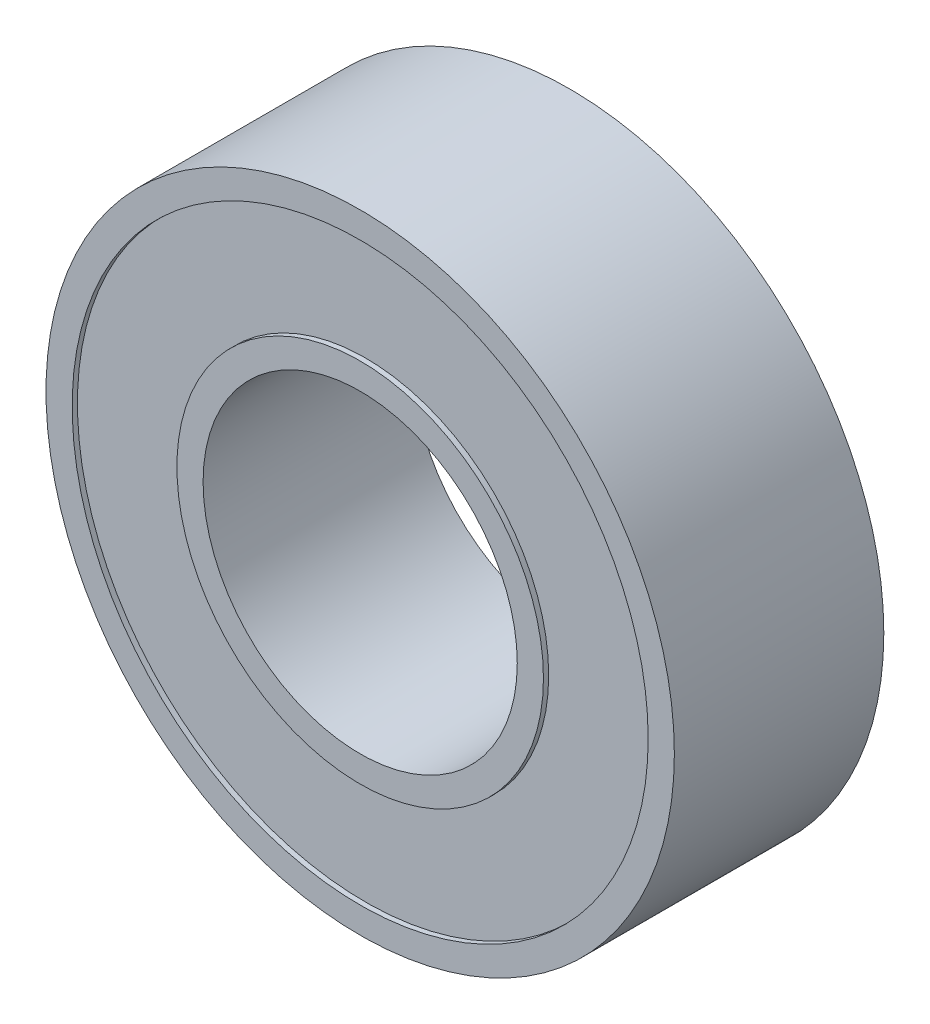
from build123d import *

# Parameters (mm, degrees)
SKETCH1_R           = 6
SKETCH1_R_2         = 3
BOSS_EXTRUDE1_DEPTH = 2
SKETCH2_R           = 5.5
SKETCH2_R_2         = 3.5
CUT_EXTRUDE1_DEPTH  = 0.1


with BuildPart() as part:
    # Sketch1 → Boss-Extrude1 (new, symmetric)
    with BuildSketch(Plane.XY):
        Circle(SKETCH1_R)
        Circle(SKETCH1_R_2, mode=Mode.SUBTRACT)
    extrude(amount=BOSS_EXTRUDE1_DEPTH, both=True)

    # Sketch2 → Cut-Extrude1 (cut)
    with BuildSketch(Plane.XY.offset(2)):
        Circle(SKETCH2_R)
        Circle(SKETCH2_R_2, mode=Mode.SUBTRACT)
    cut_extrude1 = extrude(amount=-CUT_EXTRUDE1_DEPTH, mode=Mode.SUBTRACT)

    # Mirror1: Cut-Extrude1 across plane
    add(cut_extrude1.mirror(Plane.XY), mode=Mode.SUBTRACT)


solid = part.part
